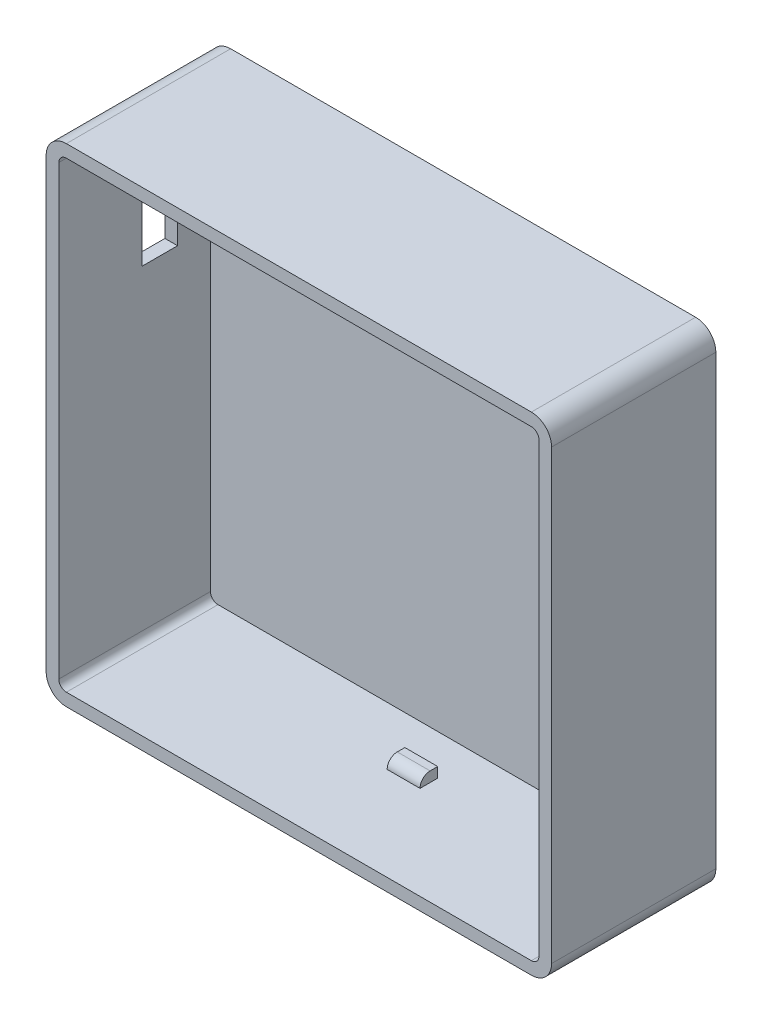
from build123d import *

# Parameters (mm, degrees)
SKETCH1_W           = 50.8
SKETCH1_H           = 49.022
BOSS_EXTRUDE2_DEPTH = 16.51
FILLET1_R           = 2.032
SHELL2_T            = -1.27
SKETCH4_W           = 3.556
SKETCH4_H           = 10.16
CUT_EXTRUDE2_DEPTH  = 1.27
SKETCH7_W           = 3.2520636
SKETCH7_H           = 1.903459875
BOSS_EXTRUDE5_DEPTH = 2.286
FILLET6_R           = 1.016
SKETCH8_W           = 1.778
SKETCH8_H           = 3.302
BOSS_EXTRUDE6_DEPTH = 2.286
FILLET7_R           = 1.016
SKETCH9_W           = 3.302
SKETCH9_H           = 1.778
BOSS_EXTRUDE7_DEPTH = 2.286
FILLET8_R           = 1.016


with BuildPart() as part:
    # Sketch1 → Boss-Extrude2 (new body)
    with BuildSketch(Plane.XY):
        with Locations((25.4, 24.511)):
            Rectangle(SKETCH1_W, SKETCH1_H)
    extrude(amount=BOSS_EXTRUDE2_DEPTH)

    # Fillet1
    fillet1_edges = [part.edges().sort_by_distance(p)[0] for p in [
        (0, 0, 8.255),
        (50.8, 0, 8.255),
        (50.8, 49.022, 8.255),
        (0, 49.022, 8.255),
    ]]
    fillet(fillet1_edges, radius=FILLET1_R)

    # Shell2
    shell2_openings = [part.faces().sort_by_distance(p)[0] for p in [
        (25.4, 24.511, 16.51),
    ]]
    offset(amount=SHELL2_T, openings=shell2_openings, kind=Kind.INTERSECTION)

    # Sketch4 → Cut-Extrude2 (cut)
    with BuildSketch(Plane.ZY):
        with Locations((6.35, 38.862)):
            Rectangle(SKETCH4_W, SKETCH4_H)
    extrude(amount=-CUT_EXTRUDE2_DEPTH, mode=Mode.SUBTRACT)

    # Sketch7 → Boss-Extrude5 (add)
    with BuildSketch(Plane(origin=(0, 49.022, 0), x_dir=(1, 0, 0), z_dir=(0, 1, 0))):
        with Locations((23.095521807, -6.285729938)):
            Rectangle(SKETCH7_W, SKETCH7_H)
    extrude(amount=-BOSS_EXTRUDE5_DEPTH)

    # Fillet6
    fillet6_edges = [part.edges().sort_by_distance(p)[0] for p in [
        (23.095521807, 46.736, 7.237459875),
    ]]
    fillet(fillet6_edges, radius=FILLET6_R - 0.0001)  # a hair under: the kernel refuses the full size

    # Sketch8 → Boss-Extrude6 (add)
    with BuildSketch(Plane(origin=(50.8, 0, 0), x_dir=(0, 0, -1), z_dir=(1, 0, 0))):
        with Locations((-6.223, 26.013260114)):
            Rectangle(SKETCH8_W, SKETCH8_H)
    extrude(amount=-BOSS_EXTRUDE6_DEPTH)

    # Fillet7
    fillet7_edges = [part.edges().sort_by_distance(p)[0] for p in [
        (48.514, 26.013260114, 7.112),
    ]]
    fillet(fillet7_edges, radius=FILLET7_R - 0.0001)  # a hair under: the kernel refuses the full size

    # Sketch9 → Boss-Extrude7 (add)
    with BuildSketch(Plane.XZ):
        with Locations((26.526394694, 6.223)):
            Rectangle(SKETCH9_W, SKETCH9_H)
    extrude(amount=-BOSS_EXTRUDE7_DEPTH)

    # Fillet8
    fillet8_edges = [part.edges().sort_by_distance(p)[0] for p in [
        (26.526394694, 2.286, 7.112),
    ]]
    fillet(fillet8_edges, radius=FILLET8_R - 0.0001)  # a hair under: the kernel refuses the full size


solid = part.part
